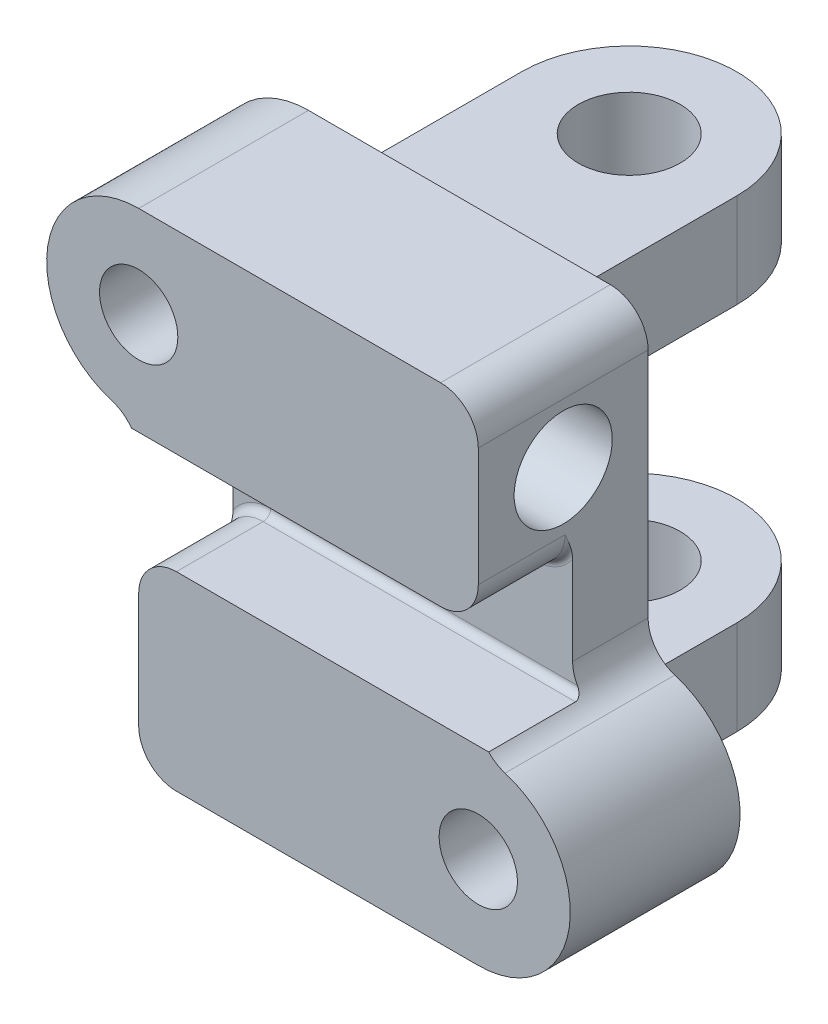
from build123d import *

# Parameters (mm, degrees)
SKETCH2_R           = 3.429
BOSS_EXTRUDE1_DEPTH = 6.35
SKETCH6_R           = 3.429
BOSS_EXTRUDE2_DEPTH = 6.35
SKETCH7_R           = 2.63525
BOSS_EXTRUDE3_DEPTH = 11.43
CUT_EXTRUDE2_START  = -6.35
CUT_EXTRUDE2_DEPTH  = 6.35
FILLET2_R           = 2.54
FILLET3_R           = 0.508
SKETCH12_R          = 3.302
CUT_EXTRUDE3_DEPTH  = 15.875
SKETCH13_R          = 3.302
CUT_EXTRUDE4_DEPTH  = 15.875


with BuildPart() as part:
    # Sketch2 → Boss-Extrude1 (new body)
    with BuildSketch(Plane(origin=(0, 0, 0), x_dir=(1, 0, 0), z_dir=(0, 1, 0))):
        with BuildLine():
            Line((-7.239, 0), (-7.239, 10.16))
            ThreePointArc((-7.239, 10.16), (0, 17.399), (7.239, 10.16))
            Line((7.239, 10.16), (7.239, 0))
            Line((7.239, 0), (-7.239, 0))
        make_face()
        with Locations(Location((0, 10.16, 0), (0, 0, 270))):
            Circle(SKETCH2_R, mode=Mode.SUBTRACT)
    extrude(amount=BOSS_EXTRUDE1_DEPTH)



with BuildPart() as body_2:
    # Sketch6 → Boss-Extrude2 (new body)
    with BuildSketch(Plane(origin=(0, 31.242, 0), x_dir=(-1, 0, 0), z_dir=(0, -1, 0))):
        with BuildLine():
            Line((7.239, 0), (-7.239, 0))
            Line((-7.239, 0), (-7.239, 10.16))
            ThreePointArc((-7.239, 10.16), (0, 17.399), (7.239, 10.16))
            Line((7.239, 10.16), (7.239, 0))
        make_face()
        with Locations(Location((0, 10.16, 0), (0, 0, 270))):
            Circle(SKETCH6_R, mode=Mode.SUBTRACT)
    extrude(amount=BOSS_EXTRUDE2_DEPTH)


with BuildPart() as part_1:
    add(part.part)

    add(body_2.part)  # Boss-Extrude3 merges body 2
    # Sketch7 → Boss-Extrude3 (add)
    with BuildSketch(Plane.XY):
        with BuildLine():
            Line((11.43, -0.73025), (-8.89, -0.73025))
            ThreePointArc((-8.89, -0.73025), (-10.686051224, 0.013698776), (-11.43, 1.80975))
            Line((-11.43, 1.80975), (-11.43, 17.427370456))
            ThreePointArc((-11.43, 17.427370456), (-11.929359281, 18.939780934), (-13.231090909, 19.857517232))
            ThreePointArc((-13.231090909, 19.857517232), (-17.553942327, 26.691443265), (-11.43, 31.97225))
            Line((-11.43, 31.97225), (8.89, 31.97225))
            ThreePointArc((8.89, 31.97225), (10.686051224, 31.228301224), (11.43, 29.43225))
            Line((11.43, 29.43225), (11.43, 13.814629544))
            ThreePointArc((11.43, 13.814629544), (11.929359281, 12.302219066), (13.231090909, 11.384482768))
            ThreePointArc((13.231090909, 11.384482768), (17.553942327, 4.550556735), (11.43, -0.73025))
        make_face()
        with Locations((-11.43, 25.781)):
            Circle(SKETCH7_R, mode=Mode.SUBTRACT)
        with Locations(Location((11.43, 5.461, 0), (0, 0, 180))):
            Circle(SKETCH7_R, mode=Mode.SUBTRACT)
    extrude(amount=BOSS_EXTRUDE3_DEPTH)

    # Sketch11 → Cut-Extrude2 (cut)
    with BuildSketch(Plane.XY.offset(11.43).offset(CUT_EXTRUDE2_START)):
        with BuildLine():
            Line((11.43, 18.923), (-11.91702843, 18.923))
            ThreePointArc((-11.91702843, 18.923), (-11.554824252, 18.213834763), (-11.43, 17.427370456))
            Line((-11.43, 17.427370456), (-11.43, 12.065))
            Line((-11.43, 12.065), (12.128697076, 12.065))
            ThreePointArc((12.128697076, 12.065), (11.611132748, 12.872639477), (11.43, 13.814629544))
            Line((11.43, 13.814629544), (11.43, 18.923))
        make_face()
    extrude(amount=CUT_EXTRUDE2_DEPTH, mode=Mode.SUBTRACT)

    # Fillet2
    fillet2_edges = [part_1.edges().sort_by_distance(p)[0] for p in [
        (11.43, 18.923, 8.255),
        (-11.43, 12.065, 8.255),
    ]]
    fillet(fillet2_edges, radius=FILLET2_R)

    # Fillet3
    fillet3_edges = [part_1.edges().sort_by_distance(p)[0] for p in [
        (-10.686051224, 11.321051224, 5.08),
        (1.619348538, 12.065, 5.08),
    ]]
    fillet(fillet3_edges, radius=FILLET3_R)
    fillet3_2_edges = [part_1.edges().sort_by_distance(p)[0] for p in [
        (-1.513514215, 18.923, 5.08),
        (10.686051224, 19.666948776, 5.08),
    ]]
    fillet(fillet3_2_edges, radius=FILLET3_R)
    fillet3_3_edges = [part_1.edges().sort_by_distance(p)[0] for p in [
        (0, 0, 0),
    ]]
    fillet(fillet3_3_edges, radius=FILLET3_R)
    fillet3_4_edges = [part_1.edges().sort_by_distance(p)[0] for p in [
        (0, 6.35, 0),
    ]]
    fillet(fillet3_4_edges, radius=FILLET3_R)
    fillet3_5_edges = [part_1.edges().sort_by_distance(p)[0] for p in [
        (0, 31.242, 0),
    ]]
    fillet(fillet3_5_edges, radius=FILLET3_R)
    fillet3_6_edges = [part_1.edges().sort_by_distance(p)[0] for p in [
        (0, 24.892, 0),
    ]]
    fillet(fillet3_6_edges, radius=FILLET3_R)
    fillet3_7_edges = [part_1.edges().sort_by_distance(p)[0] for p in [
        (7.239, 28.067, 0),
    ]]
    fillet(fillet3_7_edges, radius=FILLET3_R)
    fillet3_8_edges = [part_1.edges().sort_by_distance(p)[0] for p in [
        (-7.239, 28.067, 0),
    ]]
    fillet(fillet3_8_edges, radius=FILLET3_R)
    fillet3_9_edges = [part_1.edges().sort_by_distance(p)[0] for p in [
        (7.239, 3.175, 0),
    ]]
    fillet(fillet3_9_edges, radius=FILLET3_R - 0.0001)  # a hair under: the kernel refuses the full size
    fillet3_10_edges = [part_1.edges().sort_by_distance(p)[0] for p in [
        (-7.239, 3.175, 0),
    ]]
    fillet(fillet3_10_edges, radius=FILLET3_R - 0.0001)  # a hair under: the kernel refuses the full size

    # Sketch12 → Cut-Extrude3 (cut)
    with BuildSketch(Plane(origin=(11.43, 0, 0), x_dir=(0, 0, -1), z_dir=(1, 0, 0))):
        with Locations((-5.715, 25.447625)):
            Circle(SKETCH12_R)
    extrude(amount=-CUT_EXTRUDE3_DEPTH, mode=Mode.SUBTRACT)

    # Sketch13 → Cut-Extrude4 (cut)
    with BuildSketch(Plane.ZY.offset(11.43)):
        with Locations((5.715, 5.667375)):
            Circle(SKETCH13_R)
    extrude(amount=-CUT_EXTRUDE4_DEPTH, mode=Mode.SUBTRACT)


solid = part_1.part
